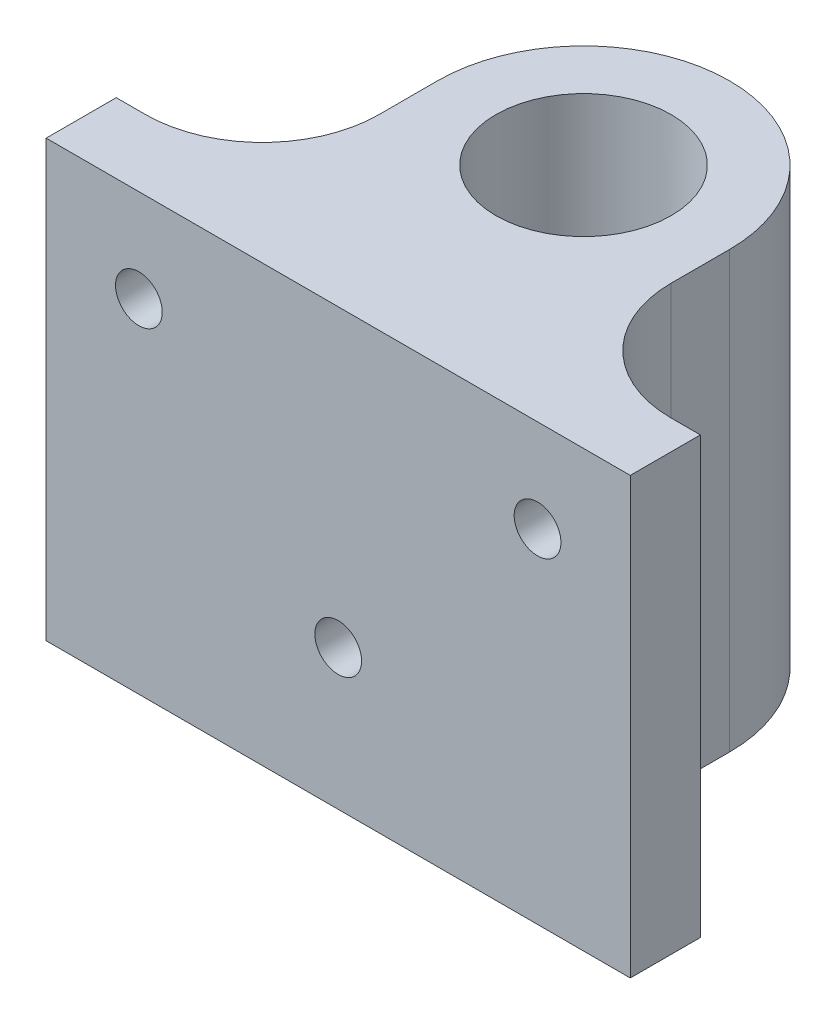
from build123d import *

# Parameters (mm, degrees)
PROFILE_SKETCH1_R                    = 7.5
PROFILE_BOSS_EXTRUDE2_DEPTH          = 37.25987
FASTENINGHOLESKETCH3_R               = 2
FASTENINGHOLECUT_EXTRUDE8_DEPTH      = 56.995963358
LM8UUFASTENINGHOLESKETCH5_R          = 2
LM8UUFASTENINGHOLECUT_EXTRUDE9_DEPTH = 56.995963425


with BuildPart() as part:
    # Profile-Sketch1 → Profile-Boss-Extrude2 (new body)
    with BuildSketch(Plane(origin=(0, 0, 0), x_dir=(1, 0, 0), z_dir=(0, 1, 0))):
        with BuildLine():
            Line((-25, -21), (25, -21))
            Line((25, -21), (25, -15))
            Line((25, -15), (22.5, -15))
            ThreePointArc((22.5, -15), (15.428932188, -12.071067812), (12.5, -5))
            Line((12.5, -5), (12.5, 0))
            ThreePointArc((12.5, 0), (0, 12.5), (-12.5, 0))
            Line((-12.5, 0), (-12.5, -5))
            ThreePointArc((-12.5, -5), (-15.428932188, -12.071067812), (-22.5, -15))
            Line((-22.5, -15), (-25, -15))
            Line((-25, -15), (-25, -21))
        make_face()
        Circle(PROFILE_SKETCH1_R, mode=Mode.SUBTRACT)
    extrude(amount=PROFILE_BOSS_EXTRUDE2_DEPTH)

    # FasteningHoleSketch3 → FasteningHoleCut-Extrude8 (cut, through all)
    with BuildSketch(Plane.XY.offset(21)):
        with Locations((-17.0625, 29.32237)):
            Circle(FASTENINGHOLESKETCH3_R)
        with Locations((17.0625, 29.32237)):
            Circle(FASTENINGHOLESKETCH3_R)
    extrude(amount=-FASTENINGHOLECUT_EXTRUDE8_DEPTH, mode=Mode.SUBTRACT)

    # LM8UUFasteningHoleSketch5 → LM8UUFasteningHoleCut-Extrude9 (cut, through all)
    with BuildSketch(Plane.XY.offset(21)):
        with Locations((0, 12)):
            Circle(LM8UUFASTENINGHOLESKETCH5_R)
    extrude(amount=-LM8UUFASTENINGHOLECUT_EXTRUDE9_DEPTH, mode=Mode.SUBTRACT)


solid = part.part
